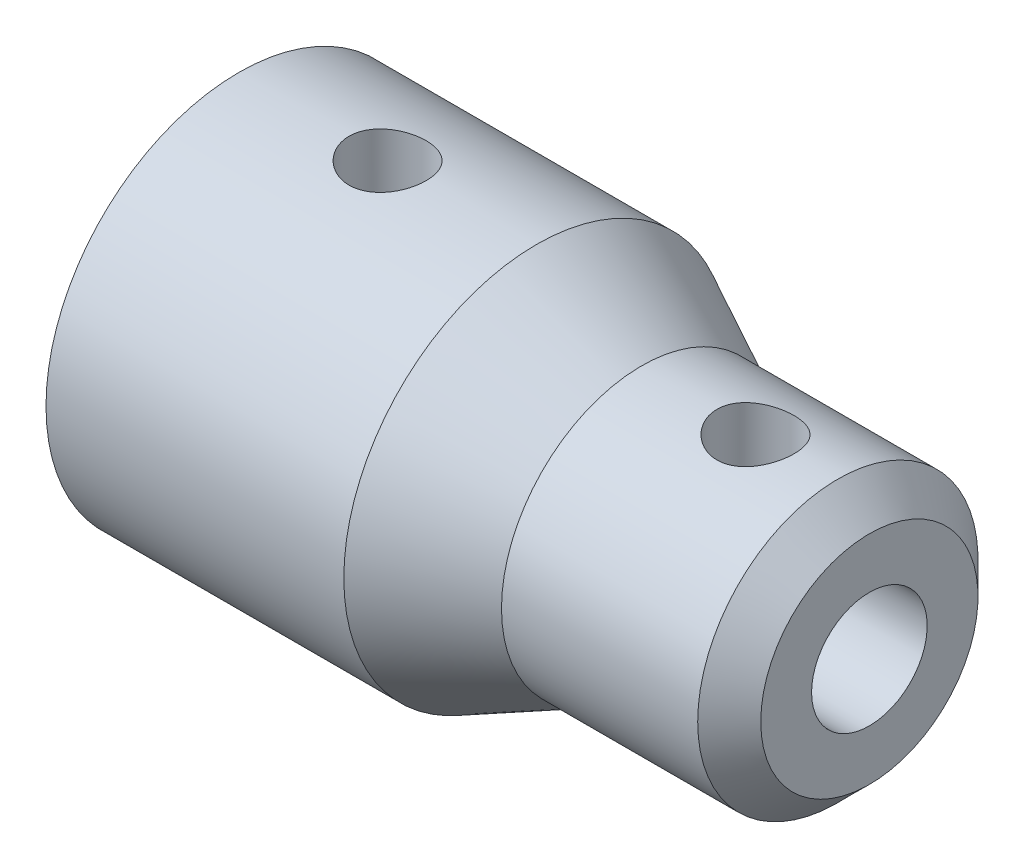
from build123d import *

# Parameters (mm, degrees)
SKETCH2_R          = 1.397
CUT_EXTRUDE1_DEPTH = 16.59309703
CIRPATTERN1_COUNT  = 2
CIRPATTERN1_ANGLE  = 90
CHAMFER1_SIZE      = 1.143


with BuildPart() as part:
    # Sketch1 → Revolve1 (revolve)
    with BuildSketch(Plane(origin=(0, 0, 0), x_dir=(1, 0, 0), z_dir=(0, 1, 0))):
        Polygon((-10.795, 3.4036), (0, 3.4036), (1.905, 2.0955), (12.065, 2.0955), (12.065, 5.08), (3.81, 5.08), (0, 6.985), (-10.795, 6.985), align=None)
    revolve(axis=Axis((0, 0, 0), (1, 0, 0)))

    # Sketch2 → Cut-Extrude1 (cut, through all)
    with BuildSketch(Plane(origin=(0, 0, 0), x_dir=(1, 0, 0), z_dir=(0, 1, 0))):
        with Locations((-5.3975, 0)):
            Circle(SKETCH2_R)
        with Locations((7.9375, 0)):
            Circle(SKETCH2_R)
    cut_extrude1 = extrude(amount=CUT_EXTRUDE1_DEPTH, mode=Mode.SUBTRACT)

    # CirPattern1: Cut-Extrude1 ×2 about axis
    cirpattern1_axis = Axis((-10.795, 0, 0), (-1, 0, 0))
    for i in range(1, CIRPATTERN1_COUNT):
        add(cut_extrude1.rotate(cirpattern1_axis, i * CIRPATTERN1_ANGLE / (CIRPATTERN1_COUNT - 1)), mode=Mode.SUBTRACT)

    # Chamfer1
    chamfer1_edges = [part.edges().sort_by_distance(p)[0] for p in [
        (12.065, 0, 5.08),
    ]]
    chamfer(chamfer1_edges, length=CHAMFER1_SIZE)


solid = part.part
